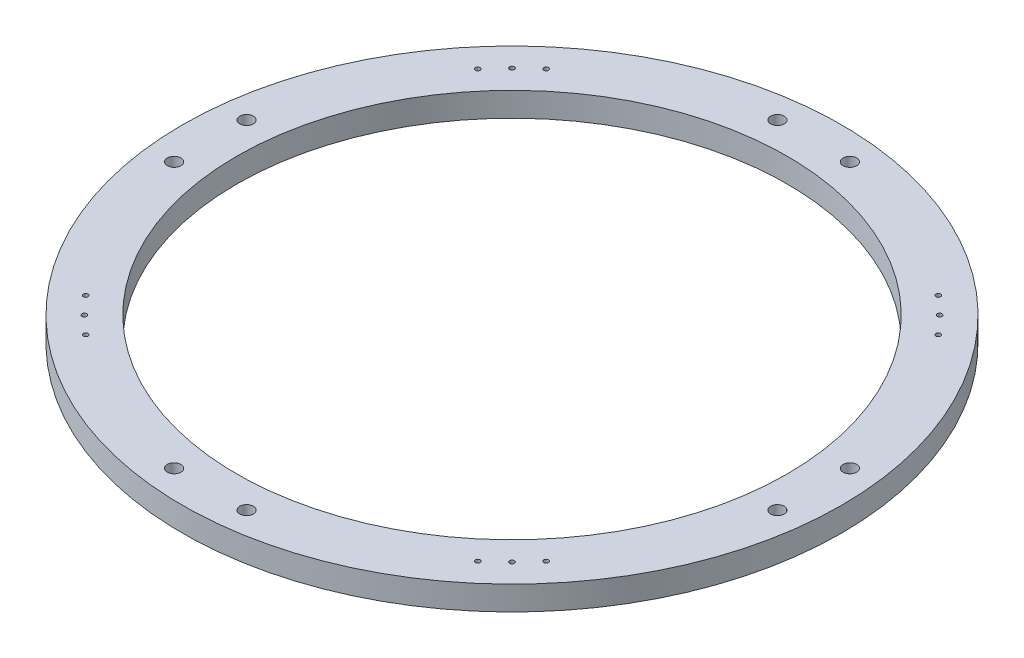
from build123d import *

# Parameters (mm, degrees)
SKETCH1_W                   = 28.575
SKETCH1_H                   = 12.7
TAP_DRILL_FOR_M3X0_5_TAP1_D = 2.5
SKETCH7_R                   = 3.571875
CUT_EXTRUDE1_DEPTH          = 246.499823849
CIRPATTERN1_COUNT           = 4


with BuildPart() as part:
    # Sketch1 → Revolve1 (revolve)
    with BuildSketch(Plane.XY):
        with Locations((159.07465491, 185.218849685)):
            Rectangle(SKETCH1_W, SKETCH1_H)
    revolve(axis=Axis((1e-09, -200000, 0), (0, 1, 0)))

    # Tap Drill for M3x0.5 Tap1 (through all)
    with Locations(Plane(origin=(0, 191.568849685, 0), x_dir=(1, 0, 0), z_dir=(0, 1, 0))):
        with Locations((-112.482767201, 112.482767201), (-103.143460894, 121.103973136), (-121.103973136, 103.143460894)):
            tap_drill_for_m3x0_5_tap1 = Hole(TAP_DRILL_FOR_M3X0_5_TAP1_D / 2)

    # Sketch7 → Cut-Extrude1 (cut, through all)
    with BuildSketch(Plane(origin=(0, 191.568849685, 0), x_dir=(1, 0, 0), z_dir=(0, 1, 0))):
        with Locations((158.674245572, -19.05)):
            Circle(SKETCH7_R)
        with Locations((158.674245572, 19.05)):
            Circle(SKETCH7_R)
    cut_extrude1 = extrude(amount=-CUT_EXTRUDE1_DEPTH, mode=Mode.SUBTRACT)

    # CirPattern1: Tap Drill for M3x0.5 Tap1, Cut-Extrude1 ×4 about axis
    cirpattern1_axis = Axis((1e-09, -200000, 0), (0, -1, 0))
    add([tap_drill_for_m3x0_5_tap1.rotate(cirpattern1_axis, i * 360 / CIRPATTERN1_COUNT) for i in range(1, CIRPATTERN1_COUNT)], mode=Mode.SUBTRACT)
    add([cut_extrude1.rotate(cirpattern1_axis, i * 360 / CIRPATTERN1_COUNT) for i in range(1, CIRPATTERN1_COUNT)], mode=Mode.SUBTRACT)


solid = part.part
